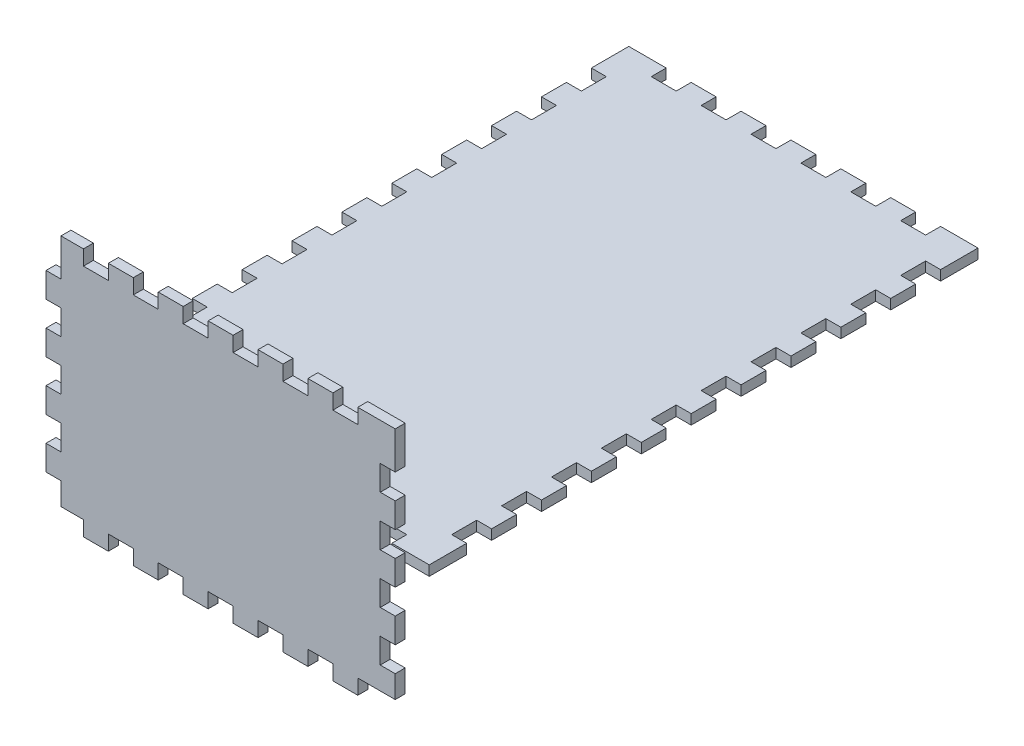
from build123d import *

# Parameters (mm, degrees)
SKETCH1_W          = 70
SKETCH1_H          = 110
BASE_FLANGE1_DEPTH = 2
SKETCH7_W          = 5
SKETCH7_H          = 3
SKETCH7_W_2        = 3
SKETCH7_H_2        = 5
CUT_EXTRUDE1_DEPTH = 10
SKETCH8_W          = 70
SKETCH8_H          = 50
BASE_FLANGE2_DEPTH = 2
SKETCH13_W         = 3
SKETCH13_H         = 7.5
SKETCH13_W_2       = 5
SKETCH13_H_2       = 3
SKETCH13_H_3       = 5
SKETCH13_W_3       = 7.5
CUT_EXTRUDE2_DEPTH = 10


with BuildPart() as part:
    # Base-Flange1: sheet metal written as solids
    # Sketch1 → Base-Flange1 (new body)
    with BuildSketch(Plane(origin=(0, 0, 0), x_dir=(1, 0, 0), z_dir=(0, 1, 0))):
        Rectangle(SKETCH1_W, SKETCH1_H)
    extrude(amount=-BASE_FLANGE1_DEPTH)

    # Sketch7 → Cut-Extrude1 (cut)
    with BuildSketch(Plane(origin=(0, 0, 0), x_dir=(1, 0, 0), z_dir=(0, 1, 0))):
        with Locations((-25, 53.5)):
            Rectangle(SKETCH7_W, SKETCH7_H)
        with Locations((-15, 53.5)):
            Rectangle(SKETCH7_W, SKETCH7_H)
        with Locations((-5, 53.5)):
            Rectangle(SKETCH7_W, SKETCH7_H)
        with Locations((5, 53.5)):
            Rectangle(SKETCH7_W, SKETCH7_H)
        with Locations((15, 53.5)):
            Rectangle(SKETCH7_W, SKETCH7_H)
        with Locations((25, 53.5)):
            Rectangle(SKETCH7_W, SKETCH7_H)
        with Locations((-33.5, 35)):
            Rectangle(SKETCH7_W_2, SKETCH7_H_2)
        with Locations((25, -53.5)):
            Rectangle(SKETCH7_W, SKETCH7_H)
        with Locations((15, -53.5)):
            Rectangle(SKETCH7_W, SKETCH7_H)
        with Locations((5, -53.5)):
            Rectangle(SKETCH7_W, SKETCH7_H)
        with Locations((-5, -53.5)):
            Rectangle(SKETCH7_W, SKETCH7_H)
        with Locations((-15, -53.5)):
            Rectangle(SKETCH7_W, SKETCH7_H)
        with Locations((-25, -53.5)):
            Rectangle(SKETCH7_W, SKETCH7_H)
        with Locations((-33.5, 45)):
            Rectangle(SKETCH7_W_2, SKETCH7_H_2)
        with Locations((-33.5, 25)):
            Rectangle(SKETCH7_W_2, SKETCH7_H_2)
        with Locations((-33.5, 15)):
            Rectangle(SKETCH7_W_2, SKETCH7_H_2)
        with Locations((-33.5, 5)):
            Rectangle(SKETCH7_W_2, SKETCH7_H_2)
        with Locations((-33.5, -5)):
            Rectangle(SKETCH7_W_2, SKETCH7_H_2)
        with Locations((-33.5, -15)):
            Rectangle(SKETCH7_W_2, SKETCH7_H_2)
        with Locations((-33.5, -25)):
            Rectangle(SKETCH7_W_2, SKETCH7_H_2)
        with Locations((-33.5, -35)):
            Rectangle(SKETCH7_W_2, SKETCH7_H_2)
        with Locations((-33.5, -45)):
            Rectangle(SKETCH7_W_2, SKETCH7_H_2)
        with Locations((33.5, -45)):
            Rectangle(SKETCH7_W_2, SKETCH7_H_2)
        with Locations((33.5, -35)):
            Rectangle(SKETCH7_W_2, SKETCH7_H_2)
        with Locations((33.5, -25)):
            Rectangle(SKETCH7_W_2, SKETCH7_H_2)
        with Locations((33.5, -15)):
            Rectangle(SKETCH7_W_2, SKETCH7_H_2)
        with Locations((33.5, -5)):
            Rectangle(SKETCH7_W_2, SKETCH7_H_2)
        with Locations((33.5, 5)):
            Rectangle(SKETCH7_W_2, SKETCH7_H_2)
        with Locations((33.5, 15)):
            Rectangle(SKETCH7_W_2, SKETCH7_H_2)
        with Locations((33.5, 25)):
            Rectangle(SKETCH7_W_2, SKETCH7_H_2)
        with Locations((33.5, 35)):
            Rectangle(SKETCH7_W_2, SKETCH7_H_2)
        with Locations((33.5, 45)):
            Rectangle(SKETCH7_W_2, SKETCH7_H_2)
    extrude(amount=-CUT_EXTRUDE1_DEPTH, mode=Mode.SUBTRACT)


with BuildPart() as body_2:
    # Base-Flange2: sheet metal written as solids
    # Sketch8 → Base-Flange2 (new body)
    with BuildSketch(Plane.XY):
        with Locations((-2.040884368, -0.023709366)):
            Rectangle(SKETCH8_W, SKETCH8_H)
    extrude(amount=-BASE_FLANGE2_DEPTH)


with BuildPart() as body_2_1:
    # Move Face4: read off the stored shape, not the designer's step
    # Move Face4: moved
    add(body_2.part.moved(Location((0, 0, 59.7807981))))


with BuildPart() as cut_extrude2_tool:
    # Sketch13 → Cut-Extrude2 (new body)
    with BuildSketch(Plane.XY.offset(59.780798073)):
        with Locations((-35.540884368, 21.226290634)):
            Rectangle(SKETCH13_W, SKETCH13_H)
        Polygon((-37.040884368, -25.023709366), (-29.540884368, -25.023709366), (-29.540884368, -22.023709366), (-34.040884368, -22.023709366), (-34.040884368, -17.523709366), (-37.040884368, -17.523709366), align=None)
        with Locations((-17.040884368, 23.476290634)):
            Rectangle(SKETCH13_W_2, SKETCH13_H_2)
        with Locations((-27.040884368, 23.476290634)):
            Rectangle(SKETCH13_W_2, SKETCH13_H_2)
        with Locations((-7.040884368, 23.476290634)):
            Rectangle(SKETCH13_W_2, SKETCH13_H_2)
        with Locations((2.959115632, 23.476290634)):
            Rectangle(SKETCH13_W_2, SKETCH13_H_2)
        with Locations((12.959115632, 23.476290634)):
            Rectangle(SKETCH13_W_2, SKETCH13_H_2)
        with Locations((22.959115632, 23.476290634)):
            Rectangle(SKETCH13_W_2, SKETCH13_H_2)
        with Locations((-35.540884368, 9.976290634)):
            Rectangle(SKETCH13_W, SKETCH13_H_3)
        with Locations((-35.540884368, -0.023709366)):
            Rectangle(SKETCH13_W, SKETCH13_H_3)
        with Locations((-35.540884368, -10.023709366)):
            Rectangle(SKETCH13_W, SKETCH13_H_3)
        with Locations((31.459115632, 14.976290634)):
            Rectangle(SKETCH13_W, SKETCH13_H_3)
        with Locations((-22.040884368, -23.523709366)):
            Rectangle(SKETCH13_W_2, SKETCH13_H_2)
        with Locations((31.459115632, -15.023709366)):
            Rectangle(SKETCH13_W, SKETCH13_H_3)
        with Locations((31.459115632, -5.023709366)):
            Rectangle(SKETCH13_W, SKETCH13_H_3)
        with Locations((31.459115632, 4.976290634)):
            Rectangle(SKETCH13_W, SKETCH13_H_3)
        with Locations((29.209115632, -23.523709366)):
            Rectangle(SKETCH13_W_3, SKETCH13_H_2)
        with Locations((17.959115632, -23.523709366)):
            Rectangle(SKETCH13_W_2, SKETCH13_H_2)
        with Locations((7.959115632, -23.523709366)):
            Rectangle(SKETCH13_W_2, SKETCH13_H_2)
        with Locations((-2.040884368, -23.523709366)):
            Rectangle(SKETCH13_W_2, SKETCH13_H_2)
        with Locations((-12.040884368, -23.523709366)):
            Rectangle(SKETCH13_W_2, SKETCH13_H_2)
    extrude(amount=-CUT_EXTRUDE2_DEPTH)


with BuildPart() as part_1:
    add(part.part)

    # Cut-Extrude2: cut by cut_extrude2_tool
    add(cut_extrude2_tool.part, mode=Mode.SUBTRACT)


with BuildPart() as body_2_2:
    add(body_2_1.part)

    # Cut-Extrude2: cut by cut_extrude2_tool
    add(cut_extrude2_tool.part, mode=Mode.SUBTRACT)


solid = Compound([part_1.part, body_2_2.part])
